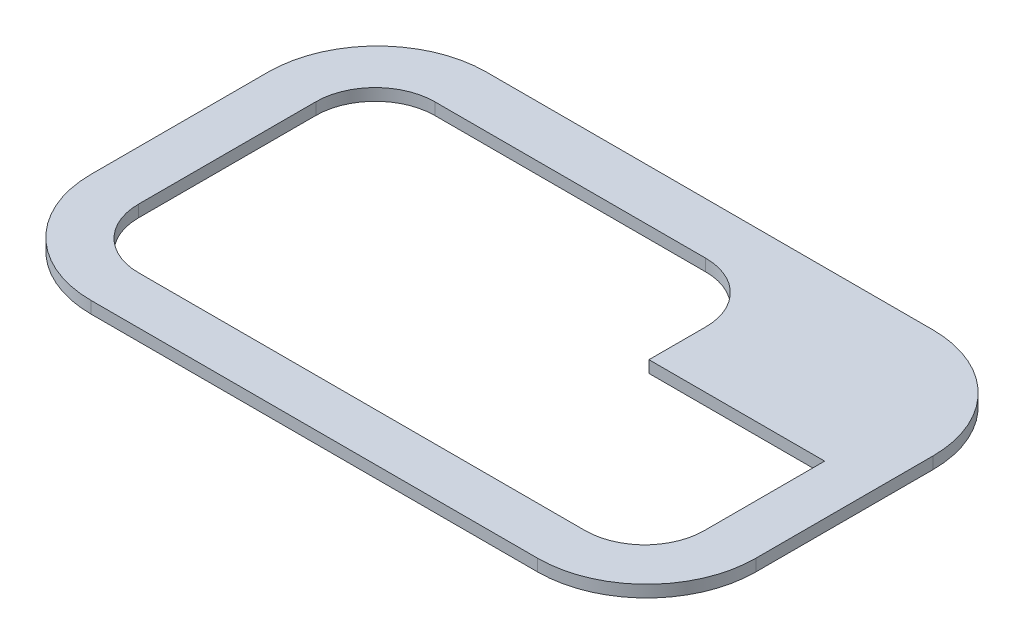
from build123d import *

# Parameters (mm, degrees)
BOSS_EXTRUDE1_DEPTH = 6


with BuildPart() as part:
    # Sketch1 → Boss-Extrude1 (new body)
    with BuildSketch(Plane(origin=(0, 0, 0), x_dir=(1, 0, 0), z_dir=(0, 1, 0))):
        with BuildLine():
            Line((-19.734220445, 34.762432298), (205.295779555, 34.762432298))
            ThreePointArc((205.295779555, 34.762432298), (244.186652521, 18.653305263), (260.295779555, -20.237567702))
            Line((260.295779555, -20.237567702), (260.295779555, -109.497567702))
            ThreePointArc((260.295779555, -109.497567702), (244.186652521, -148.388440667), (205.295779555, -164.497567702))
            Line((205.295779555, -164.497567702), (-19.734220445, -164.497567702))
            ThreePointArc((-19.734220445, -164.497567702), (-58.62509341, -148.388440667), (-74.734220445, -109.497567702))
            Line((-74.734220445, -109.497567702), (-74.734220445, -20.237567702))
            ThreePointArc((-74.734220445, -20.237567702), (-58.62509341, 18.653305263), (-19.734220445, 34.762432298))
        make_face()
        with BuildLine():
            Line((-19.764381797, 8.794287146), (116.735618203, 8.794287146))
            ThreePointArc((116.735618203, 8.794287146), (137.948821638, 0.007490582), (146.735618203, -21.205712854))
            Line((146.735618203, -21.205712854), (146.735618203, -49.805712854))
            Line((146.735618203, -49.805712854), (235.265618203, -49.805712854))
            Line((235.265618203, -49.805712854), (235.265618203, -110.465712854))
            ThreePointArc((235.265618203, -110.465712854), (226.478821638, -131.678916289), (205.265618203, -140.465712854))
            Line((205.265618203, -140.465712854), (146.735618203, -140.465712854))
            Line((146.735618203, -140.465712854), (-19.764381797, -140.465712854))
            ThreePointArc((-19.764381797, -140.465712854), (-40.977585233, -131.678916289), (-49.764381797, -110.465712854))
            Line((-49.764381797, -110.465712854), (-49.764381797, -21.205712854))
            ThreePointArc((-49.764381797, -21.205712854), (-40.977585233, 0.007490582), (-19.764381797, 8.794287146))
        make_face(mode=Mode.SUBTRACT)
    extrude(amount=BOSS_EXTRUDE1_DEPTH)


solid = part.part
